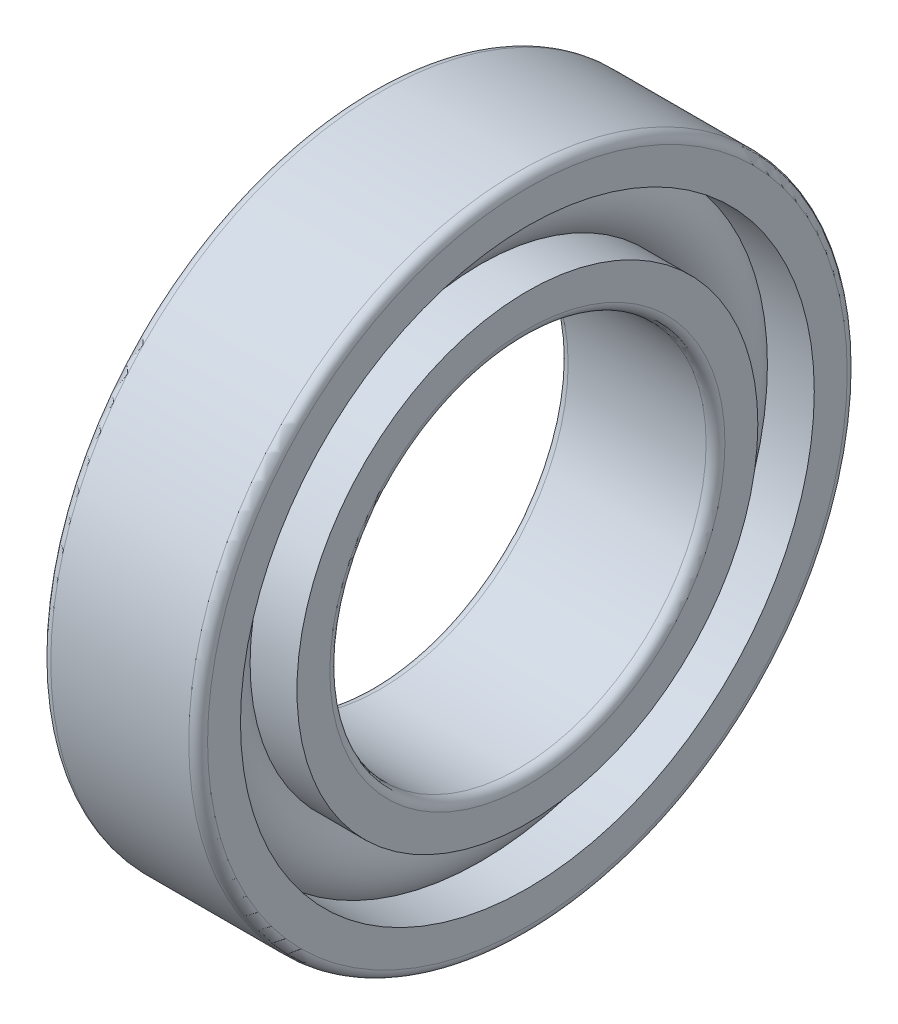
from build123d import *

# Parameters (mm, degrees)
CAGSPISKE_W     = 0.27
CAGSPISKE_H     = 0.45
CAGESPINE_ANGLE = 0.001
BALSIMSKE_R     = 1.35


with BuildPart() as part:
    # CagSpiSke → CageSpine (revolve)
    with BuildSketch(Plane.XY):
        with Locations((0, 8.25)):
            Rectangle(CAGSPISKE_W, CAGSPISKE_H)
    revolve(axis=Axis((-20.6375, 0, 0), (-1, 0, 0)), revolution_arc=CAGESPINE_ANGLE)

    # BalSimSke → BallsSimplified (revolve)
    with BuildSketch(Plane.XY):
        with Locations((0, 8.25)):
            Circle(BALSIMSKE_R)
    revolve(axis=Axis((-10, 0, 0), (1, 0, 0)))

    # InnRacSke → InnerRace (revolve)
    with BuildSketch(Plane.XY):
        with BuildLine():
            Line((-0.972432517, 7.35), (-2.5, 7.35))
            Line((-2.5, 7.35), (-2.5, 6.3))
            ThreePointArc((-2.5, 6.3), (-2.412132034, 6.087867966), (-2.2, 6))
            Line((-2.2, 6), (2.2, 6))
            ThreePointArc((2.2, 6), (2.412132034, 6.087867966), (2.5, 6.3))
            Line((2.5, 6.3), (2.5, 7.35))
            Line((2.5, 7.35), (0.972432517, 7.35))
            ThreePointArc((0.972432517, 7.35), (0, 6.925), (-0.972432517, 7.35))
        make_face()
    revolve(axis=Axis((-20.6375, 0, 0), (1, 0, 0)))

    # OutRacSke → OuterRace (revolve)
    with BuildSketch(Plane.XY):
        with BuildLine():
            Line((-0.972432517, 9.15), (-2.5, 9.15))
            Line((-2.5, 9.15), (-2.5, 10.2))
            ThreePointArc((-2.5, 10.2), (-2.412132034, 10.412132034), (-2.2, 10.5))
            Line((-2.2, 10.5), (2.2, 10.5))
            ThreePointArc((2.2, 10.5), (2.412132034, 10.412132034), (2.5, 10.2))
            Line((2.5, 10.2), (2.5, 9.15))
            Line((2.5, 9.15), (0.972432517, 9.15))
            ThreePointArc((0.972432517, 9.15), (0, 9.575), (-0.972432517, 9.15))
        make_face()
    revolve(axis=Axis((-20.6375, 0, 0), (1, 0, 0)))


solid = part.part
